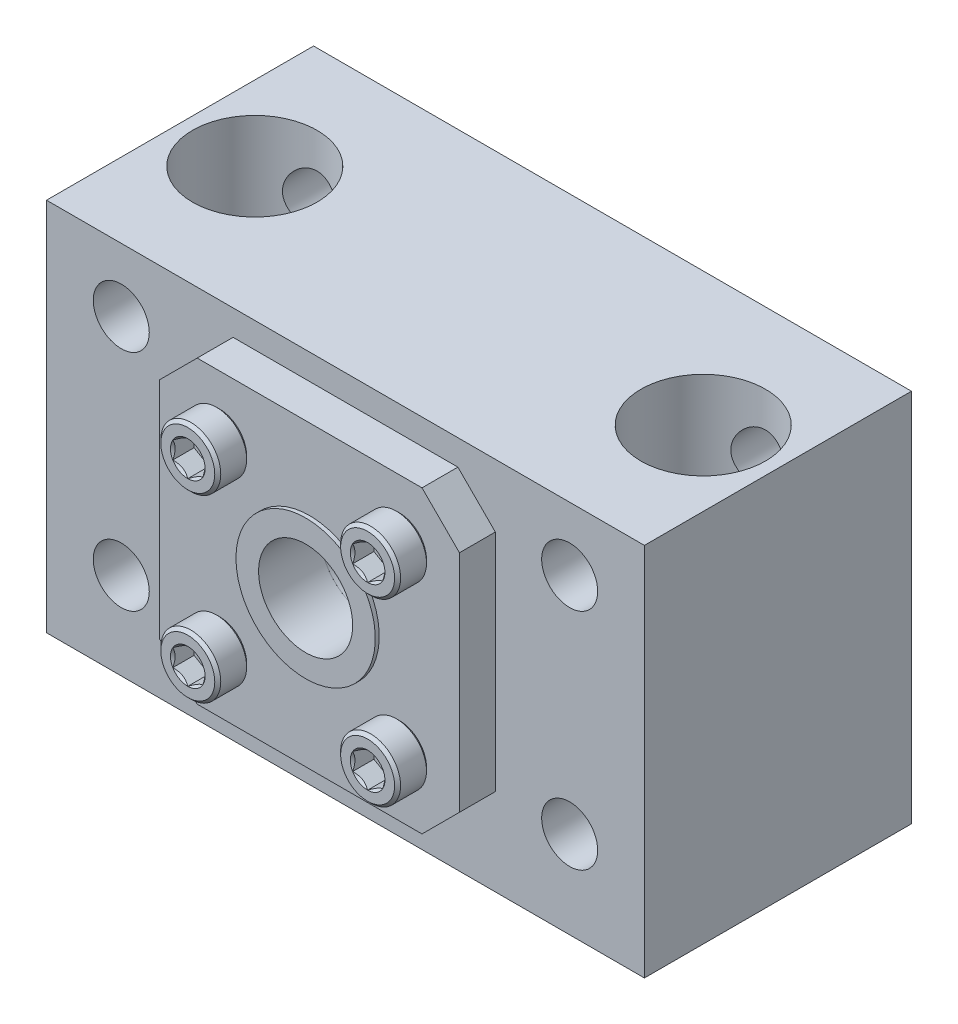
from build123d import *

# Parameters (mm, degrees)
BOSS_EXTRUDE1_DEPTH      = 17.018
BOSS_EXTRUDE1_DEPTH_BACK = 17.018
SKETCH3_W                = 76.2
SKETCH3_H                = 47.752
SKETCH3_R                = 6
SKETCH3_R_2              = 3.5687
SKETCH4_R                = 6
BOSS_EXTRUDE2_DEPTH      = 4.572
SKETCH5_R                = 3.82016
BOSS_EXTRUDE3_DEPTH      = 4.064
SKETCH6_W                = 2.709333333
SKETCH6_H                = 1.91008
CUT_EXTRUDE3_DEPTH       = 2.709333333
SKETCH9_R                = 5.1562
CUT_EXTRUDE1_DEPTH       = 67.257008837
SKETCH10_R               = 7.9375
CUT_EXTRUDE2_DEPTH       = 22.225
SKETCH13_W               = 7.9248
SKETCH13_H               = 2.88
REVOLVE1_START           = 14.1732
REVOLVE1_OUTLINE_R       = 8.88
REVOLVE1_OUTLINE_R_2     = 6
REVOLVE1_DEPTH           = 7.9248
REVOLVE1_START_2         = -17.526
REVOLVE1_2_OUTLINE_R     = 8.88
REVOLVE1_2_OUTLINE_R_2   = 6
REVOLVE1_2_DEPTH         = 7.9248


with BuildPart() as part:
    # Sketch3 → Boss-Extrude1 (new, two sides: drawn at the far end of the back side and taken through both)
    with BuildSketch(Plane.XY.offset(-BOSS_EXTRUDE1_DEPTH_BACK)):
        with Locations((0, -1.524)):
            Rectangle(SKETCH3_W, SKETCH3_H)
        Circle(SKETCH3_R, mode=Mode.SUBTRACT)
        with Locations((-28.575, 14.2875)):
            Circle(SKETCH3_R_2, mode=Mode.SUBTRACT)
        with Locations((28.575, 14.2875)):
            Circle(SKETCH3_R_2, mode=Mode.SUBTRACT)
        with Locations((-28.575, -14.2875)):
            Circle(SKETCH3_R_2, mode=Mode.SUBTRACT)
        with Locations((28.575, -14.2875)):
            Circle(SKETCH3_R_2, mode=Mode.SUBTRACT)
    extrude(amount=BOSS_EXTRUDE1_DEPTH + BOSS_EXTRUDE1_DEPTH_BACK)

    # Sketch9 → Cut-Extrude1 (cut, through all)
    with BuildSketch(Plane(origin=(0, 22.352, 0), x_dir=(1, 0, 0), z_dir=(0, 1, 0))):
        with Locations(Location((-28.575, 0, 0), (0, 0, 270))):
            Circle(SKETCH9_R)
        with Locations(Location((28.575, 0, 0), (0, 0, 270))):
            Circle(SKETCH9_R)
    extrude(amount=-CUT_EXTRUDE1_DEPTH, mode=Mode.SUBTRACT)

    # Sketch10 → Cut-Extrude2 (cut)
    with BuildSketch(Plane(origin=(0, 22.352, 0), x_dir=(1, 0, 0), z_dir=(0, 1, 0))):
        with Locations(Location((-28.575, 0, 0), (0, 0, 270))):
            Circle(SKETCH10_R)
        with Locations(Location((28.575, 0, 0), (0, 0, 270))):
            Circle(SKETCH10_R)
    extrude(amount=-CUT_EXTRUDE2_DEPTH, mode=Mode.SUBTRACT)


with BuildPart() as body_2:
    # Sketch4 → Boss-Extrude2 (new body)
    with BuildSketch(Plane.XY.offset(17.018)):
        Polygon((-19.1008, 14.3256), (-19.1008, -14.3256), (-14.3256, -19.1008), (14.3256, -19.1008), (19.1008, -14.3256), (19.1008, 14.3256), (14.3256, 19.1008), (-14.3256, 19.1008), align=None)
        Circle(SKETCH4_R, mode=Mode.SUBTRACT)
    extrude(amount=BOSS_EXTRUDE2_DEPTH)


with BuildPart() as body_3:
    # Sketch5 → Boss-Extrude3 (new body)
    with BuildSketch(Plane.XY.offset(21.59)):
        with Locations((11.46048, 11.46048)):
            Circle(SKETCH5_R)
    extrude(amount=BOSS_EXTRUDE3_DEPTH)

    # Sketch6 → Cut-Revolve1 (revolve, cut)
    with BuildSketch(Plane(origin=(11.46048, 0, 0), x_dir=(0, 0, -1), z_dir=(1, 0, 0)), mode=Mode.PRIVATE) as cut_revolve1_sk:
        Polygon((-25.271984, 15.28064), (-25.654, 15.28064), (-25.654, 14.898624), align=None)
        Polygon((-21.972016, 15.28064), (-21.59, 15.28064), (-21.59, 14.898624), align=None)
        with Locations((-24.299333334, 12.41552)):
            Rectangle(SKETCH6_W, SKETCH6_H)
    revolve(cut_revolve1_sk.sketch.rotate(Axis((11.46048, 11.46048, 24.299333333), (0, 0, -1)), 90), axis=Axis((11.46048, 11.46048, 24.299333333), (0, 0, -1)), mode=Mode.SUBTRACT)

    # Sketch11 → Cut-Extrude3 (cut)
    with BuildSketch(Plane.XY.offset(25.654)):
        Polygon((11.46048, 13.666050404), (9.5504, 12.563265202), (9.5504, 10.357694798), (11.46048, 9.254909596), (13.37056, 10.357694798), (13.37056, 12.563265202), align=None)
    extrude(amount=-CUT_EXTRUDE3_DEPTH, mode=Mode.SUBTRACT)

    # Cut-Extrude4 cone 1 section (through the dimple's axis) → Cut-Extrude4 (revolve, cut)
    with BuildSketch(Plane(origin=(11.46048, 11.46048, 25.654), x_dir=(0, -1, 0), z_dir=(1, 0, 0))):
        Polygon((0, 0), (2.205570404, 0), (0, 2.205570404), align=None)
    revolve(axis=Axis((11.46048, 11.46048, 25.654), (0, 0, -1)), mode=Mode.SUBTRACT)


with BuildPart() as body_4:
    # Sketch-Pattern1: read off the stored shape, not the designer's step
    # Sketch-Pattern1: copy of body 3
    add(body_3.part.moved(Location((1.9e-06, -22.9209609, 0))))


with BuildPart() as body_5:
    # Sketch-Pattern1 2: copy of body 3
    add(body_3.part.moved(Location((-22.9209581, -22.9209609, 0))))


with BuildPart() as body_6:
    # Sketch-Pattern1 3: copy of body 3
    add(body_3.part.moved(Location((-22.9209581, -9e-07, 0))))


with BuildPart() as cut_revolve2_tool:
    # Sketch13 → Cut-Revolve2 (revolve)
    with BuildSketch(Plane(origin=(0, 0, 0), x_dir=(0, 0, -1), z_dir=(1, 0, 0))):
        with Locations((-18.1356, 7.44)):
            Rectangle(SKETCH13_W, SKETCH13_H)
        with Locations((13.5636, 7.44)):
            Rectangle(SKETCH13_W, SKETCH13_H)
    revolve(axis=Axis((0, 0, 21.59), (0, 0, -1)))


with BuildPart() as part_1:
    add(part.part)

    # Cut-Revolve2: cut by cut_revolve2_tool
    add(cut_revolve2_tool.part, mode=Mode.SUBTRACT)


with BuildPart() as body_2_1:
    add(body_2.part)

    # Cut-Revolve2: cut by cut_revolve2_tool
    add(cut_revolve2_tool.part, mode=Mode.SUBTRACT)


with BuildPart() as body_7:
    # Revolve1: read off the stored shape, not the designer's step
    # Revolve1 outline → Revolve1 (new body)
    with BuildSketch(Plane.XY.offset(REVOLVE1_START)):
        Circle(REVOLVE1_OUTLINE_R)
        Circle(REVOLVE1_OUTLINE_R_2, mode=Mode.SUBTRACT)
    extrude(amount=REVOLVE1_DEPTH)


with BuildPart() as body_8:
    # Revolve1 2 outline → Revolve1 2 (new body)
    with BuildSketch(Plane.XY.offset(REVOLVE1_START_2)):
        Circle(REVOLVE1_2_OUTLINE_R)
        Circle(REVOLVE1_2_OUTLINE_R_2, mode=Mode.SUBTRACT)
    extrude(amount=REVOLVE1_2_DEPTH)


solid = Compound([body_3.part, body_4.part, body_5.part, body_6.part, part_1.part, body_2_1.part, body_7.part, body_8.part])
